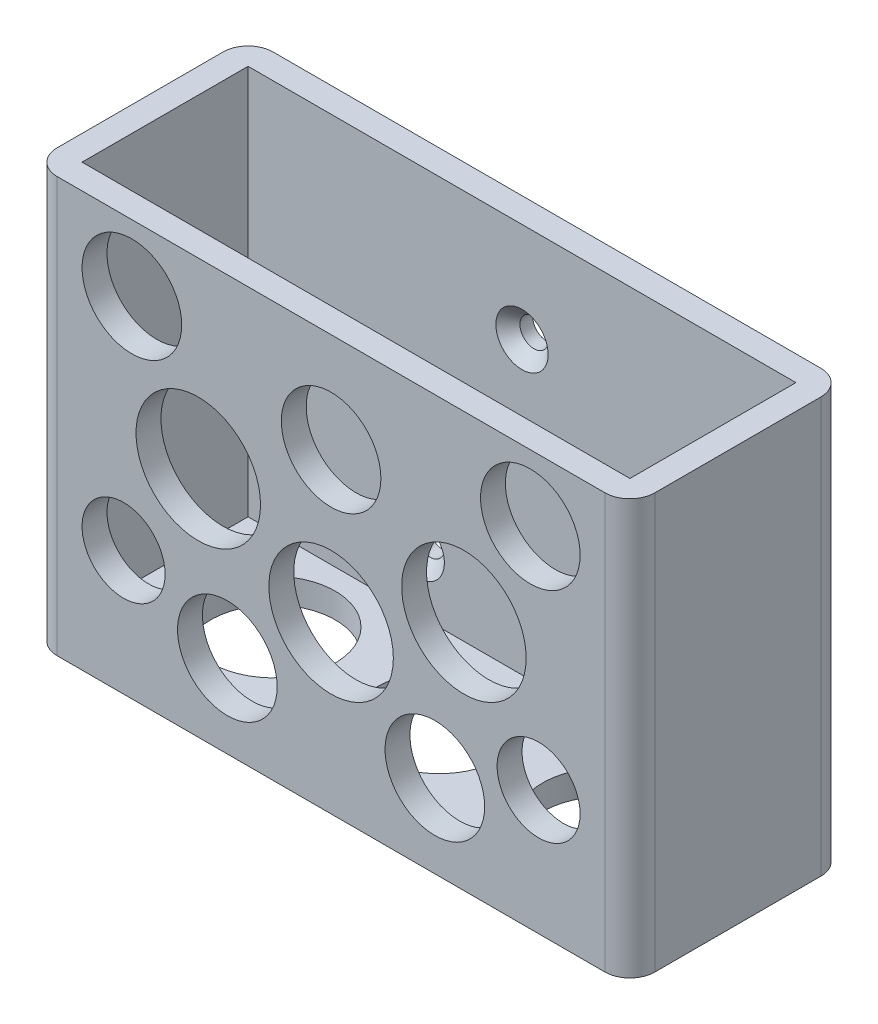
from build123d import *

# Parameters (mm, degrees)
SKETCH1_W                                    = 72
SKETCH1_H                                    = 26
BOSS_EXTRUDE1_DEPTH                          = 50
FILLET1_R                                    = 3
SHELL1_START                                 = -33
SHELL1_OUTLINE_W                             = 47
SHELL1_OUTLINE_H                             = 20
SHELL1_DEPTH                                 = 66
SKETCH2_R                                    = 7.5
CUT_EXTRUDE1_DEPTH                           = 61.613529843
CSK_FOR_M3_COUNTERSUNK_FLAT_HEAD_SCR_2_COUNT = 2
CSK_FOR_M3_COUNTERSUNK_FLAT_HEAD_SCR_2_PITCH = 30.663496213
CSK_FOR_M3_COUNTERSUNK_FLAT_HEAD_SCR_3_COUNT = 2
CSK_FOR_M3_COUNTERSUNK_FLAT_HEAD_SCR_3_PITCH = 30.663496213
CUT_EXTRUDE2_REACH                           = 68.873
SKETCH6_R                                    = 6
SKETCH6_R_2                                  = 7.5
SKETCH6_R_3                                  = 5


# Read off the part's stored shape, not the designer's step: Shell1
with BuildPart() as part:
    # Sketch1 → Boss-Extrude1 (new body)
    with BuildSketch(Plane(origin=(0, 0, 0), x_dir=(1, 0, 0), z_dir=(0, 1, 0))):
        Rectangle(SKETCH1_W, SKETCH1_H)
    extrude(amount=BOSS_EXTRUDE1_DEPTH)

    # Fillet1
    fillet1_edges = [part.edges().sort_by_distance(p)[0] for p in [
        (-36, 25, -13),
        (36, 25, -13),
        (36, 25, 13),
        (-36, 25, 13),
    ]]
    fillet(fillet1_edges, radius=FILLET1_R)

    # Shell1 outline → Shell1 (cut)
    with BuildSketch(Plane.YZ.offset(SHELL1_START)):
        with Locations((26.5, 0)):
            Rectangle(SHELL1_OUTLINE_W, SHELL1_OUTLINE_H)
    extrude(amount=SHELL1_DEPTH, mode=Mode.SUBTRACT)

    # Sketch2 → Cut-Extrude1 (cut, through all)
    with BuildSketch(Plane(origin=(0, 3, 0), x_dir=(1, 0, 0), z_dir=(0, 1, 0))):
        with Locations(Location((0, 0, 0), (0, 0, 270))):
            Circle(SKETCH2_R)
        with Locations(Location((-20, 0, 0), (0, 0, 270))):
            Circle(SKETCH2_R)
        with Locations(Location((20, 0, 0), (0, 0, 270))):
            Circle(SKETCH2_R)
    extrude(amount=-CUT_EXTRUDE1_DEPTH, mode=Mode.SUBTRACT)

    # Sketch4 → CSK for M3 Countersunk Flat Head Screw1 (revolve, cut)
    with BuildSketch(Plane(origin=(0, 38, -10), x_dir=(0, -1, 0), z_dir=(1, 0, 0))):
        Polygon((0, 0), (0, 3), (1.7, 3), (1.7, 1.45), (3.15, 0), align=None)
    csk_for_m3_countersunk_flat_head_screw1 = revolve(axis=Axis((0, 38, -3.65), (0, 0, -1)), mode=Mode.SUBTRACT)

    # CSK for M3 Countersunk Flat Head Scr 2: CSK for M3 Countersunk Flat Head Screw1 ×2
    with Locations(*[Vector(-0.4076508403738889, -0.9131378824375114, 0) * (i * CSK_FOR_M3_COUNTERSUNK_FLAT_HEAD_SCR_2_PITCH) for i in range(1, CSK_FOR_M3_COUNTERSUNK_FLAT_HEAD_SCR_2_COUNT)]):
        add(csk_for_m3_countersunk_flat_head_screw1, mode=Mode.SUBTRACT)

    # CSK for M3 Countersunk Flat Head Scr 3: CSK for M3 Countersunk Flat Head Screw1 ×2
    with Locations(*[Vector(0.4076508403738889, -0.9131378824375114, 0) * (i * CSK_FOR_M3_COUNTERSUNK_FLAT_HEAD_SCR_3_PITCH) for i in range(1, CSK_FOR_M3_COUNTERSUNK_FLAT_HEAD_SCR_3_COUNT)]):
        add(csk_for_m3_countersunk_flat_head_screw1, mode=Mode.SUBTRACT)

    # Sketch6 → Cut-Extrude2 (cut, up to next)
    with BuildSketch(Plane.XY.offset(13), mode=Mode.PRIVATE) as cut_extrude2_sk1:
        with Locations((0, 38)):
            Circle(SKETCH6_R)
    cut_extrude2_tool1 = extrude(cut_extrude2_sk1.sketch, amount=-CUT_EXTRUDE2_REACH, mode=Mode.PRIVATE) & part.part
    # Sketch6 → Cut-Extrude2 (cut, up to next)
    with BuildSketch(Plane.XY.offset(13), mode=Mode.PRIVATE) as cut_extrude2_sk2:
        with Locations((-12.5, 10)):
            Circle(SKETCH6_R)
    cut_extrude2_tool2 = extrude(cut_extrude2_sk2.sketch, amount=-CUT_EXTRUDE2_REACH, mode=Mode.PRIVATE) & part.part
    # Sketch6 → Cut-Extrude2 (cut, up to next)
    with BuildSketch(Plane.XY.offset(13), mode=Mode.PRIVATE) as cut_extrude2_sk3:
        with Locations((12.5, 10)):
            Circle(SKETCH6_R)
    cut_extrude2_tool3 = extrude(cut_extrude2_sk3.sketch, amount=-CUT_EXTRUDE2_REACH, mode=Mode.PRIVATE) & part.part
    # Sketch6 → Cut-Extrude2 (cut, up to next)
    with BuildSketch(Plane.XY.offset(13), mode=Mode.PRIVATE) as cut_extrude2_sk4:
        with Locations((0, 20)):
            Circle(SKETCH6_R_2)
    cut_extrude2_tool4 = extrude(cut_extrude2_sk4.sketch, amount=-CUT_EXTRUDE2_REACH, mode=Mode.PRIVATE) & part.part
    # Sketch6 → Cut-Extrude2 (cut, up to next)
    with BuildSketch(Plane.XY.offset(13), mode=Mode.PRIVATE) as cut_extrude2_sk5:
        with Locations((24, 42)):
            Circle(SKETCH6_R)
    cut_extrude2_tool5 = extrude(cut_extrude2_sk5.sketch, amount=-CUT_EXTRUDE2_REACH, mode=Mode.PRIVATE) & part.part
    # Sketch6 → Cut-Extrude2 (cut, up to next)
    with BuildSketch(Plane.XY.offset(13), mode=Mode.PRIVATE) as cut_extrude2_sk6:
        with Locations((16, 28)):
            Circle(SKETCH6_R_2)
    cut_extrude2_tool6 = extrude(cut_extrude2_sk6.sketch, amount=-CUT_EXTRUDE2_REACH, mode=Mode.PRIVATE) & part.part
    # Sketch6 → Cut-Extrude2 (cut, up to next)
    with BuildSketch(Plane.XY.offset(13), mode=Mode.PRIVATE) as cut_extrude2_sk7:
        with Locations((-16, 28)):
            Circle(SKETCH6_R_2)
    cut_extrude2_tool7 = extrude(cut_extrude2_sk7.sketch, amount=-CUT_EXTRUDE2_REACH, mode=Mode.PRIVATE) & part.part
    # Sketch6 → Cut-Extrude2 (cut, up to next)
    with BuildSketch(Plane.XY.offset(13), mode=Mode.PRIVATE) as cut_extrude2_sk8:
        with Locations((-24, 42)):
            Circle(SKETCH6_R)
    cut_extrude2_tool8 = extrude(cut_extrude2_sk8.sketch, amount=-CUT_EXTRUDE2_REACH, mode=Mode.PRIVATE) & part.part
    # Sketch6 → Cut-Extrude2 (cut, up to next)
    with BuildSketch(Plane.XY.offset(13), mode=Mode.PRIVATE) as cut_extrude2_sk9:
        with Locations((25, 15)):
            Circle(SKETCH6_R_3)
    cut_extrude2_tool9 = extrude(cut_extrude2_sk9.sketch, amount=-CUT_EXTRUDE2_REACH, mode=Mode.PRIVATE) & part.part
    # Sketch6 → Cut-Extrude2 (cut, up to next)
    with BuildSketch(Plane.XY.offset(13), mode=Mode.PRIVATE) as cut_extrude2_sk10:
        with Locations((-25, 15)):
            Circle(SKETCH6_R_3)
    cut_extrude2_tool10 = extrude(cut_extrude2_sk10.sketch, amount=-CUT_EXTRUDE2_REACH, mode=Mode.PRIVATE) & part.part
    add(cut_extrude2_tool1.solids().sort_by_distance((0, 38, 13))[0], mode=Mode.SUBTRACT)
    add(cut_extrude2_tool2.solids().sort_by_distance((-12.5, 10, 13))[0], mode=Mode.SUBTRACT)
    add(cut_extrude2_tool3.solids().sort_by_distance((12.5, 10, 13))[0], mode=Mode.SUBTRACT)
    add(cut_extrude2_tool4.solids().sort_by_distance((0, 20, 13))[0], mode=Mode.SUBTRACT)
    add(cut_extrude2_tool5.solids().sort_by_distance((24, 42, 13))[0], mode=Mode.SUBTRACT)
    add(cut_extrude2_tool6.solids().sort_by_distance((16, 28, 13))[0], mode=Mode.SUBTRACT)
    add(cut_extrude2_tool7.solids().sort_by_distance((-16, 28, 13))[0], mode=Mode.SUBTRACT)
    add(cut_extrude2_tool8.solids().sort_by_distance((-24, 42, 13))[0], mode=Mode.SUBTRACT)
    add(cut_extrude2_tool9.solids().sort_by_distance((25, 15, 13))[0], mode=Mode.SUBTRACT)
    add(cut_extrude2_tool10.solids().sort_by_distance((-25, 15, 13))[0], mode=Mode.SUBTRACT)


solid = part.part
